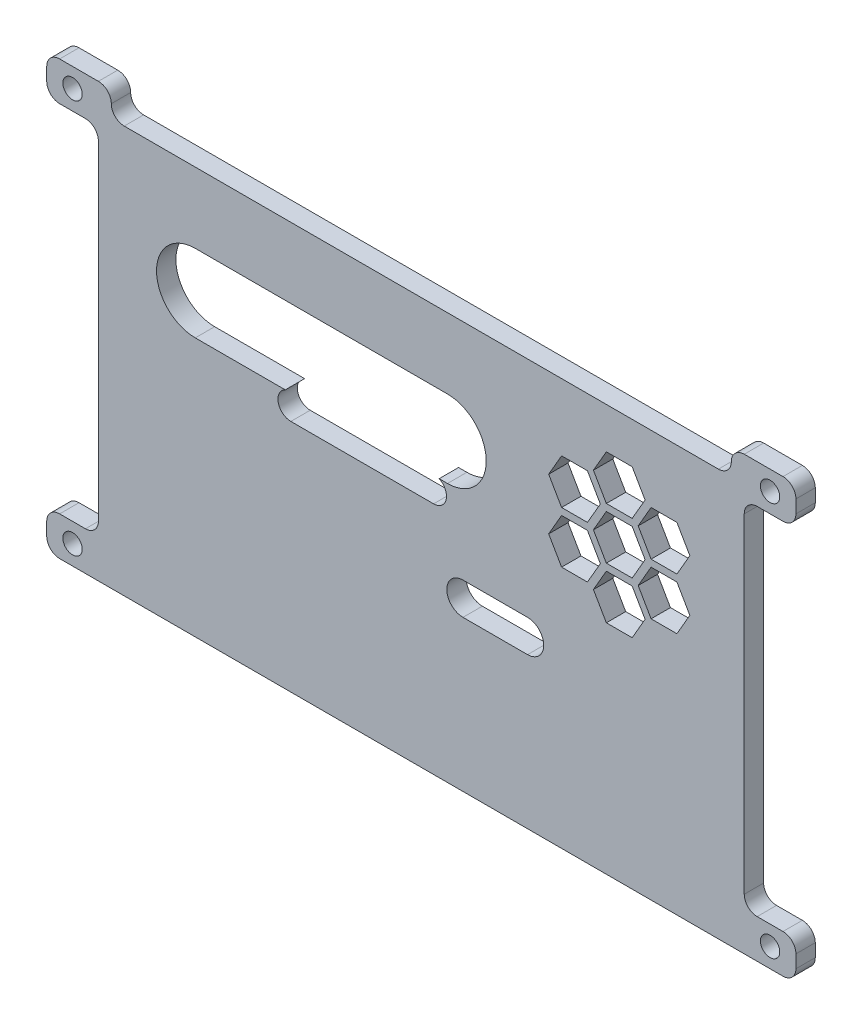
from build123d import *

# Parameters (mm, degrees)
SKETCH3_W           = 100
SKETCH3_H           = 63
BOSS_EXTRUDE1_DEPTH = 3
BOSS_EXTRUDE2_START = -3
SKETCH5_W           = 8
SKETCH5_H           = 6
BOSS_EXTRUDE2_DEPTH = 3
FILLET2_R           = 2
CUT_EXTRUDE1_DEPTH  = 3
CUT_EXTRUDE2_START  = -3
CUT_EXTRUDE2_DEPTH  = 3
CUT_EXTRUDE3_START  = -3
SKETCH8_W           = 39.05
SKETCH8_H           = 6
CUT_EXTRUDE3_DEPTH  = 3
SKETCH9_R           = 1.5
CUT_EXTRUDE4_DEPTH  = 10
FILL_PATTERN1_DEPTH = 3


# Read off the part's stored shape, not the designer's step: Cut-Extrude2, Fill Pattern1
with BuildPart() as part:
    # Sketch3 → Boss-Extrude1 (new body)
    with BuildSketch(Plane.XY):
        Rectangle(SKETCH3_W, SKETCH3_H)
    extrude(amount=BOSS_EXTRUDE1_DEPTH)

    # Sketch5 → Boss-Extrude2 (add)
    with BuildSketch(Plane(origin=(0, 0, 0), x_dir=(-1, 0, 0), z_dir=(0, 0, -1)).offset(BOSS_EXTRUDE2_START)):
        with Locations((-54, -28.5)):
            Rectangle(SKETCH5_W, SKETCH5_H)
        Polygon((-58, 29.5), (-50, 29.5), (-50, 31.5), (-48, 31.5), (-48, 35.5), (-58, 35.5), align=None)
        with Locations((54, -28.5)):
            Rectangle(SKETCH5_W, SKETCH5_H)
        Polygon((48, 35.5), (48, 31.5), (50, 31.5), (50, 29.5), (58, 29.5), (58, 35.5), align=None)
    extrude(amount=BOSS_EXTRUDE2_DEPTH)

    # Fillet2
    fillet2_edges = [part.edges().sort_by_distance(p)[0] for p in [
        (48, 35.5, 1.5),
        (58, 35.5, 1.5),
        (58, 29.5, 1.5),
        (50, 29.5, 1.5),
        (58, -31.5, 1.5),
        (58, -25.5, 1.5),
        (50, -25.5, 1.5),
        (-58, -31.5, 1.5),
        (-58, -25.5, 1.5),
        (-50, -25.5, 1.5),
        (-50, 29.5, 1.5),
        (-58, 29.5, 1.5),
        (-58, 35.5, 1.5),
        (-48, 35.5, 1.5),
        (-48, 31.5, 1.5),
        (48, 31.5, 1.5),
    ]]
    fillet(fillet2_edges, radius=FILLET2_R - 0.0001)  # a hair under: the kernel refuses the full size

    # Sketch6 → Cut-Extrude1 (cut)
    with BuildSketch(Plane.XY.offset(3)):
        with BuildLine():
            ThreePointArc((6.45, -3.15), (4.682233047, -3.882233047), (3.95, -5.65))
            Line((3.95, -5.65), (11.45, -5.65))
            Line((11.45, -5.65), (11.45, -3.15))
            Line((11.45, -3.15), (6.45, -3.15))
        make_face()
        with BuildLine():
            Line((11.45, -3.15), (11.45, -5.65))
            Line((11.45, -5.65), (18.95, -5.65))
            ThreePointArc((18.95, -5.65), (18.217766953, -3.882233047), (16.45, -3.15))
            Line((16.45, -3.15), (11.45, -3.15))
        make_face()
        with BuildLine():
            Line((18.95, -5.65), (11.45, -5.65))
            Line((11.45, -5.65), (11.45, -8.15))
            Line((11.45, -8.15), (16.45, -8.15))
            ThreePointArc((16.45, -8.15), (18.217766953, -7.417766953), (18.95, -5.65))
        make_face()
        with BuildLine():
            Line((11.45, -5.65), (3.95, -5.65))
            ThreePointArc((3.95, -5.65), (4.682233047, -7.417766953), (6.45, -8.15))
            Line((6.45, -8.15), (11.45, -8.15))
            Line((11.45, -8.15), (11.45, -5.65))
        make_face()
    extrude(amount=-CUT_EXTRUDE1_DEPTH, mode=Mode.SUBTRACT)

    # Cut-Extrude2 outline → Cut-Extrude2 (cut)
    with BuildSketch(Plane.XY.offset(3).offset(CUT_EXTRUDE2_START)):
        with BuildLine():
            Line((-11.2, 8.796347875), (-20.2, 8.796347875))
            ThreePointArc((-20.2, 8.796347875), (-22.2, 6.796347875), (-20.2, 4.796347875))
            Line((-20.2, 4.796347875), (1.9, 4.796347875))
            ThreePointArc((1.9, 4.796347875), (3.9, 6.796347875), (1.9, 8.796347875))
            Line((1.9, 8.796347875), (-11.19861108, 8.796347875))
            Line((-11.19861108, 8.796347875), (-11.2, 8.796347875))
        make_face()
    extrude(amount=CUT_EXTRUDE2_DEPTH, mode=Mode.SUBTRACT)

    # Sketch8 → Cut-Extrude3 (cut)
    with BuildSketch(Plane.XY.offset(3).offset(CUT_EXTRUDE3_START)):
        with BuildLine():
            Line((4.05, 14.6), (-35, 14.6))
            Line((-35, 14.6), (-35, 8.6))
            Line((-35, 8.6), (-21.064198479, 8.6))
            ThreePointArc((-21.064198479, 8.6), (-20.643111582, 8.746643269), (-20.2, 8.796347875))
            Line((-20.2, 8.796347875), (-11.2, 8.796347875))
            Line((-11.2, 8.796347875), (-11.19861108, 8.796347392))
            Line((-11.19861108, 8.796347392), (1.9, 8.796347875))
            ThreePointArc((1.9, 8.796347875), (2.343111582, 8.746643269), (2.764198479, 8.6))
            Line((2.764198479, 8.6), (4.05, 8.6))
            Line((4.05, 8.6), (4.05, 14.6))
        make_face()
        with BuildLine():
            ThreePointArc((-35, 20.6), (-39.242640687, 18.842640687), (-41, 14.6))
            Line((-41, 14.6), (-35, 14.6))
            Line((-35, 14.6), (-35, 20.6))
        make_face()
        with BuildLine():
            Line((-35, 14.6), (-41, 14.6))
            ThreePointArc((-41, 14.6), (-39.242640687, 10.357359313), (-35, 8.6))
            Line((-35, 8.6), (-35, 14.6))
        make_face()
        with Locations((-15.475, 17.6)):
            Rectangle(SKETCH8_W, SKETCH8_H)
        with BuildLine():
            Line((4.05, 20.6), (4.05, 14.6))
            Line((4.05, 14.6), (10.05, 14.6))
            ThreePointArc((10.05, 14.6), (8.292640687, 18.842640687), (4.05, 20.6))
        make_face()
        with BuildLine():
            Line((10.05, 14.6), (4.05, 14.6))
            Line((4.05, 14.6), (4.05, 8.6))
            ThreePointArc((4.05, 8.6), (8.292640687, 10.357359313), (10.05, 14.6))
        make_face()
    extrude(amount=CUT_EXTRUDE3_DEPTH, mode=Mode.SUBTRACT)

    # Sketch9 → Cut-Extrude4 (cut)
    with BuildSketch(Plane(origin=(0, 0, 0), x_dir=(-1, 0, 0), z_dir=(0, 0, -1))):
        with Locations((-54, 32.520438715)):
            Circle(SKETCH9_R)
        with Locations((54, 32.520438715)):
            Circle(SKETCH9_R)
        with Locations((-54, -28.5)):
            Circle(SKETCH9_R)
        with Locations((54, -28.5)):
            Circle(SKETCH9_R)
    extrude(amount=-CUT_EXTRUDE4_DEPTH, mode=Mode.SUBTRACT)

    # Fill Pattern1 outline → Fill Pattern1 (cut)
    with BuildSketch(Plane.XY):
        Polygon((34.648052979, 5.68067969), (32.648052979, 9.144781305), (28.648052979, 9.144781305), (26.648052979, 5.68067969), (28.648052979, 2.216578074), (32.648052979, 2.216578074), align=None)
        Polygon((27.719849748, 17.68067969), (25.719849748, 21.144781305), (21.719849748, 21.144781305), (19.719849748, 17.68067969), (21.719849748, 14.216578074), (25.719849748, 14.216578074), align=None)
        Polygon((35.576256209, 21.144781305), (33.576256209, 17.68067969), (35.576256209, 14.216578074), (39.576256209, 14.216578074), (41.576256209, 17.68067969), (39.576256209, 21.144781305), align=None)
        Polygon((34.648052979, 21.68067969), (32.648052979, 25.144781305), (28.648052979, 25.144781305), (26.648052979, 21.68067969), (28.648052979, 18.216578074), (32.648052979, 18.216578074), align=None)
        Polygon((41.576256209, 9.68067969), (39.576256209, 13.144781305), (35.576256209, 13.144781305), (33.576256209, 9.68067969), (35.576256209, 6.216578074), (39.576256209, 6.216578074), align=None)
        Polygon((21.719849748, 13.144781305), (19.719849748, 9.68067969), (21.719849748, 6.216578074), (25.719849748, 6.216578074), (27.719849748, 9.68067969), (25.719849748, 13.144781305), align=None)
        Polygon((34.648052979, 13.68067969), (32.648052979, 17.144781305), (28.648052979, 17.144781305), (26.648052979, 13.68067969), (28.648052979, 10.216578074), (32.648052979, 10.216578074), align=None)
    extrude(amount=FILL_PATTERN1_DEPTH, mode=Mode.SUBTRACT)


solid = part.part
